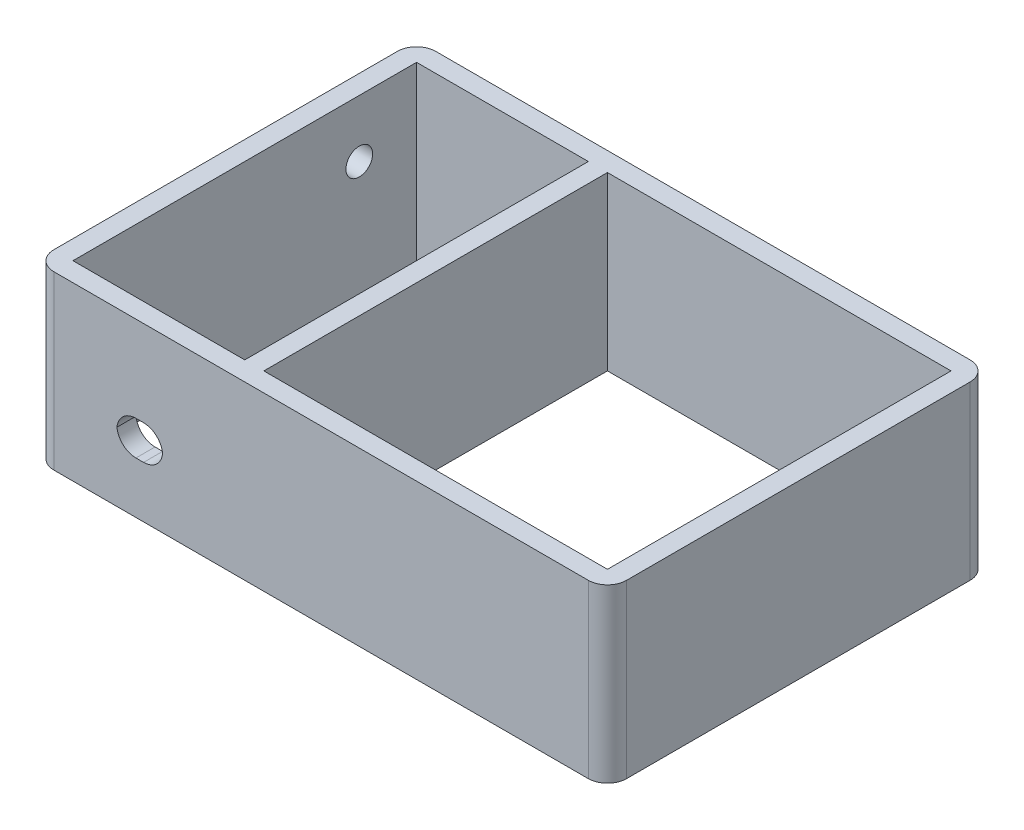
from build123d import *

# Parameters (mm, degrees)
SKETCH2_W           = 150
SKETCH2_H           = 100
SKETCH2_W_2         = 140
SKETCH2_H_2         = 90
BOSS_EXTRUDE3_DEPTH = 45
FILLET1_R           = 5
SKETCH3_W           = 5
SKETCH3_H           = 90
BOSS_EXTRUDE4_DEPTH = 45
SKETCH5_W           = 12
SKETCH5_H           = 9
CUT_EXTRUDE1_DEPTH  = 5
FILLET2_R           = 5
SKETCH6_R           = 3.5
CUT_EXTRUDE2_DEPTH  = 5


with BuildPart() as part:
    # Sketch2 → Boss-Extrude3 (new body)
    with BuildSketch(Plane(origin=(0, 0, 0), x_dir=(1, 0, 0), z_dir=(0, 1, 0))):
        Rectangle(SKETCH2_W, SKETCH2_H)
        Rectangle(SKETCH2_W_2, SKETCH2_H_2, mode=Mode.SUBTRACT)
    extrude(amount=BOSS_EXTRUDE3_DEPTH)

    # Fillet1
    fillet1_edges = [part.edges().sort_by_distance(p)[0] for p in [
        (75, 22.5, 50),
        (-75, 22.5, 50),
        (-75, 22.5, -50),
        (75, 22.5, -50),
    ]]
    fillet(fillet1_edges, radius=FILLET1_R)

    # Sketch3 → Boss-Extrude4 (add)
    with BuildSketch(Plane(origin=(0, 0, 0), x_dir=(1, 0, 0), z_dir=(0, 1, 0))):
        with Locations((-22.5, 0)):
            Rectangle(SKETCH3_W, SKETCH3_H)
    extrude(amount=BOSS_EXTRUDE4_DEPTH)

    # Sketch5 → Cut-Extrude1 (cut)
    with BuildSketch(Plane.XY.offset(50)):
        with Locations((-47.5, 18)):
            Rectangle(SKETCH5_W, SKETCH5_H)
    extrude(amount=-CUT_EXTRUDE1_DEPTH, mode=Mode.SUBTRACT)

    # Fillet2
    # the kernel refuses this fillet: 5 mm, written as the material it adds along each edge
    with BuildSketch(Plane(origin=(-53.5, 13.5, 50), x_dir=(0, 1, 0), z_dir=(0, 0, -1))) as fillet2_piece_1:
        with BuildLine():
            CenterArc((FILLET2_R, FILLET2_R), FILLET2_R, 180, 90)
            Line((0, FILLET2_R), (0, 0))
            Line((0, 0), (FILLET2_R, 0))
        make_face()
    extrude(amount=5)
    with BuildSketch(Plane(origin=(-53.5, 22.5, 50), x_dir=(0, -1, 0), z_dir=(0, 0, -1)), Plane(origin=(-41.5, 22.5, 50), x_dir=(-1, 0, 0), z_dir=(0, 0, -1)), Plane(origin=(-41.5, 13.5, 50), x_dir=(0, 1, 0), z_dir=(0, 0, -1))) as fillet2_piece_2:
        with BuildLine():
            CenterArc((FILLET2_R, -FILLET2_R), FILLET2_R, 90, 90)
            Line((0, -FILLET2_R), (0, 0))
            Line((0, 0), (FILLET2_R, 0))
        make_face()
    extrude(amount=5)

    # Sketch6 → Cut-Extrude2 (cut)
    with BuildSketch(Plane.ZY.offset(75)):
        with Locations((-30, 30)):
            Circle(SKETCH6_R)
    extrude(amount=-CUT_EXTRUDE2_DEPTH, mode=Mode.SUBTRACT)


solid = part.part
